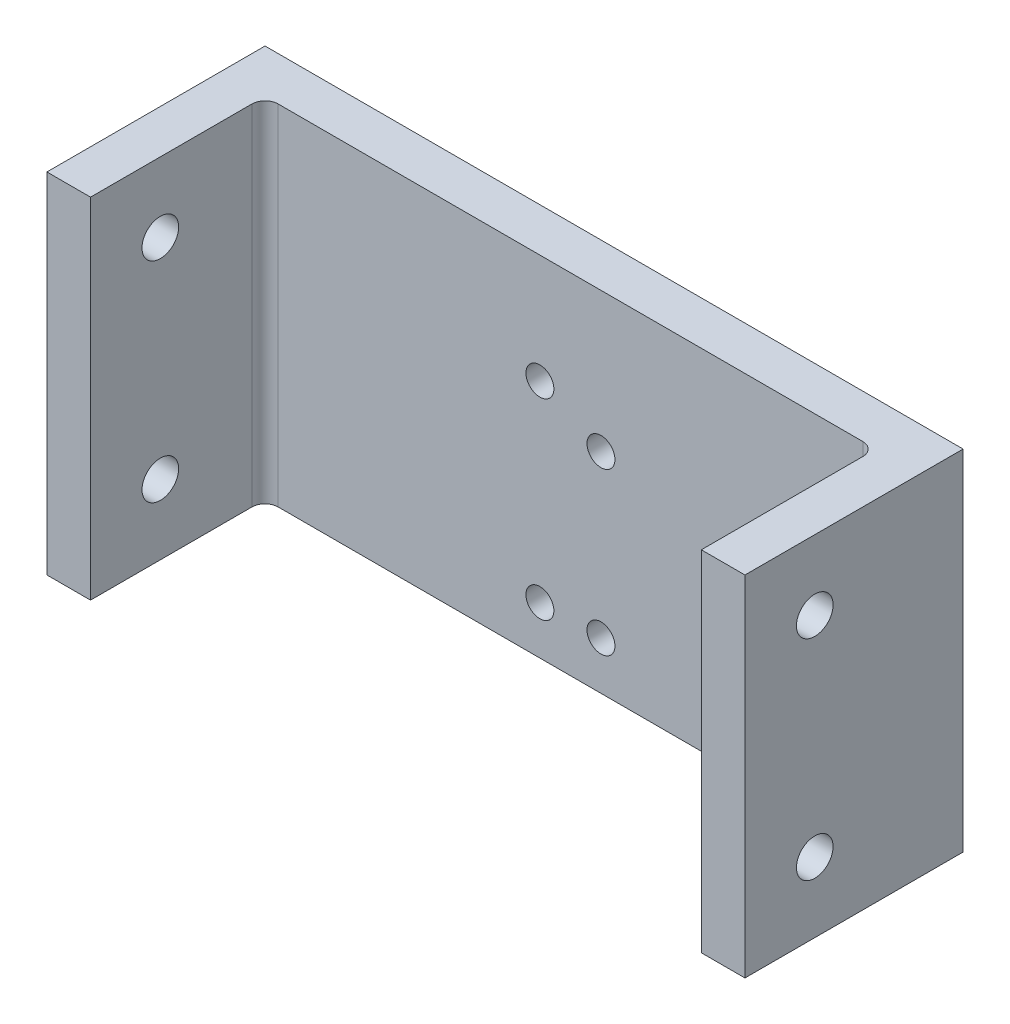
from build123d import *

# Parameters (mm, degrees)
EXTRUDE_1_DEPTH     = 40
FILLET_1_R          = 1.5
SKETCH_3_R          = 1.6
CUT_EXTRUDE_1_DEPTH = 40
SKETCH_4_R          = 2.1
CUT_EXTRUDE_2_DEPTH = 80
SKETCH_5_R          = 1.6
CUT_EXTRUDE_3_DEPTH = 80


with BuildPart() as part:
    # 草图2 → 凸台-拉伸1 (new body)
    with BuildSketch(Plane(origin=(0, 37, 0), x_dir=(1, 0, 0), z_dir=(0, 1, 0))):
        Polygon((21, 0), (-59, 0), (-59, -25), (-54, -25), (-54, -5), (16, -5), (16, -25), (21, -25), align=None)
    extrude(amount=-EXTRUDE_1_DEPTH)

    # 圆角1
    fillet_1_edges = [part.edges().sort_by_distance(p)[0] for p in [
        (16, 17, 5),
        (-54, 17, 5),
    ]]
    fillet(fillet_1_edges, radius=FILLET_1_R)

    # 草图3 → 切除-拉伸1 (cut)
    with BuildSketch(Plane.XY.offset(5)):
        with Locations((-22.5, 2.5)):
            Circle(SKETCH_3_R)
        with Locations((-22.5, 24.5)):
            Circle(SKETCH_3_R)
    extrude(amount=-CUT_EXTRUDE_1_DEPTH, mode=Mode.SUBTRACT)

    # 草图4 → 切除-拉伸2 (cut)
    with BuildSketch(Plane.ZY.offset(59)):
        with Locations((17, 29)):
            Circle(SKETCH_4_R)
        with Locations((17, 5)):
            Circle(SKETCH_4_R)
    extrude(amount=-CUT_EXTRUDE_2_DEPTH, mode=Mode.SUBTRACT)

    # 草图5 → 切除-拉伸3 (cut)
    with BuildSketch(Plane.XY.offset(5)):
        with Locations((-15.5, 2.5)):
            Circle(SKETCH_5_R)
        with Locations((-15.5, 21)):
            Circle(SKETCH_5_R)
    extrude(amount=-CUT_EXTRUDE_3_DEPTH, mode=Mode.SUBTRACT)


solid = part.part
